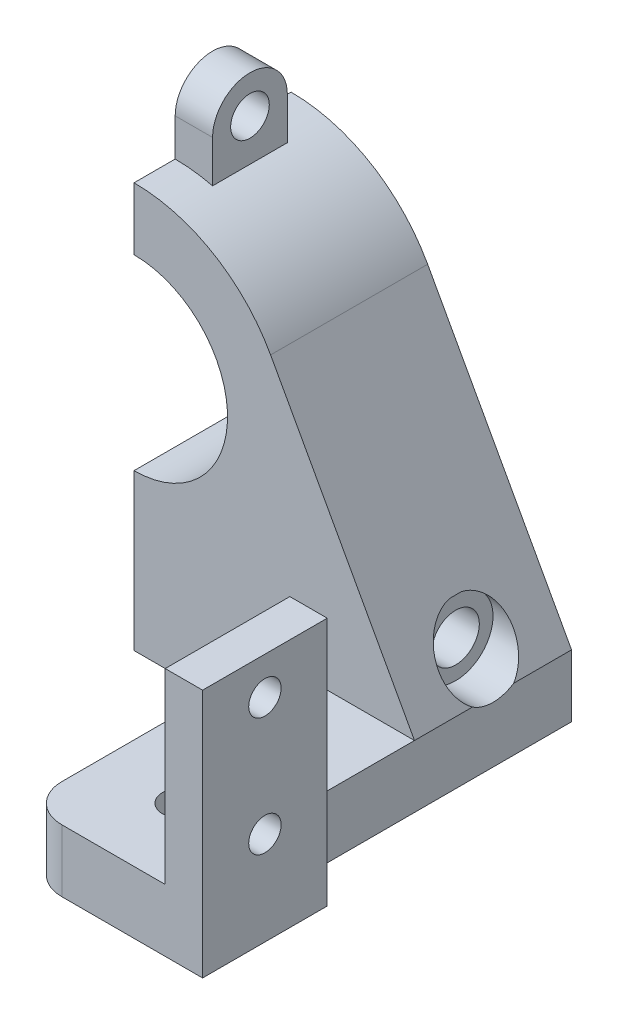
from build123d import *

# Parameters (mm, degrees)
SKETCH_1_R          = 7.5
EXTRUDE_1_DEPTH     = 12.6
SKETCH_2_W          = 11.291748881
SKETCH_2_H          = 5
EXTRUDE_2_DEPTH     = 32.6
SKETCH_3_R          = 1.5
CUT_EXTRUDE_1_DEPTH = 45.373528145
FILLET_1_R          = 3
SKETCH_4_W          = 3
SKETCH_4_H          = 10
EXTRUDE_3_DEPTH     = 20
SKETCH_5_R          = 1.3
CUT_EXTRUDE_2_DEPTH = 46.967488511
SKETCH_6_W          = 35.293936169
SKETCH_6_H          = 34.958158763
CUT_EXTRUDE_3_DEPTH = 46.967488511
EXTRUDE_4_OUTLINE_R = 1.55
EXTRUDE_4_DEPTH     = 3
SKETCH_8_R          = 1.900956558
CUT_EXTRUDE_4_DEPTH = 46.967488511
SKETCH_9_R          = 3
CUT_EXTRUDE_5_DEPTH = 3


# Read off the part's stored shape, not the designer's step: 凸台-拉伸4
with BuildPart() as part:
    # 草图1 → 凸台-拉伸1 (new body)
    with BuildSketch(Plane.XY):
        with BuildLine():
            Line((-10.956194261, 6.017624724), (-22.5, -15))
            Line((-22.5, -15), (-22.5, -20))
            Line((-22.5, -20), (22.5, -20))
            Line((22.5, -20), (22.5, -15))
            Line((22.5, -15), (10.956194261, 6.017624724))
            ThreePointArc((10.956194261, 6.017624724), (0, 12.5), (-10.956194261, 6.017624724))
        make_face()
        Circle(SKETCH_1_R, mode=Mode.SUBTRACT)
    extrude(amount=EXTRUDE_1_DEPTH)

    # 草图2 → 凸台-拉伸2 (add)
    with BuildSketch(Plane.XY):
        with Locations((-16.854125559, -17.5)):
            Rectangle(SKETCH_2_W, SKETCH_2_H)
        with Locations((16.854125559, -17.5)):
            Rectangle(SKETCH_2_W, SKETCH_2_H)
    extrude(amount=EXTRUDE_2_DEPTH)

    # 草图3 → 切除-拉伸1 (cut, through all)
    with BuildSketch(Plane(origin=(0, 0, 0), x_dir=(1, 0, 0), z_dir=(0, 1, 0))):
        with Locations(Location((-17.5, -26.3, 0), (0, 0, 270))):
            Circle(SKETCH_3_R)
        with Locations((17.5, -26.3)):
            Circle(SKETCH_3_R)
    extrude(amount=-CUT_EXTRUDE_1_DEPTH, mode=Mode.SUBTRACT)

    # 圆角1
    fillet_1_edges = [part.edges().sort_by_distance(p)[0] for p in [
        (-22.5, -17.5, 32.6),
        (-11.208251119, -17.5, 32.6),
        (11.208251119, -17.5, 32.6),
    ]]
    fillet(fillet_1_edges, radius=FILLET_1_R)

    # 草图4 → 凸台-拉伸3 (add, through all)
    with BuildSketch(Plane(origin=(0, 0, 0), x_dir=(1, 0, 0), z_dir=(0, 1, 0))):
        with Locations((24, -27.6)):
            Rectangle(SKETCH_4_W, SKETCH_4_H)
    extrude(amount=-EXTRUDE_3_DEPTH)

    # 草图5 → 切除-拉伸2 (cut, through all)
    with BuildSketch(Plane(origin=(0, 0, 0), x_dir=(0, 0, -1), z_dir=(1, 0, 0))):
        with Locations(Location((-27.6, -3, 0), (0, 0, 180))):
            Circle(SKETCH_5_R)
        with Locations(Location((-27.6, -12.5, 0), (0, 0, 180))):
            Circle(SKETCH_5_R)
    extrude(amount=CUT_EXTRUDE_2_DEPTH, mode=Mode.SUBTRACT)

    # 草图6 → 切除-拉伸3 (cut, through all)
    with BuildSketch(Plane(origin=(0, 0, 0), x_dir=(0, 0, -1), z_dir=(1, 0, 0))):
        with Locations((-16.337308601, -3.7126914)):
            Rectangle(SKETCH_6_W, SKETCH_6_H)
    extrude(amount=-CUT_EXTRUDE_3_DEPTH, mode=Mode.SUBTRACT)

    # 凸台-拉伸4 outline → 凸台-拉伸4 (add)
    with BuildSketch(Plane(origin=(0, 0, 0), x_dir=(0, 0, -1), z_dir=(1, 0, 0))):
        with BuildLine():
            Line((-9.3, 15.5), (-9.3, 9.152926334))
            Line((-9.3, 9.152926334), (-3.3, 9.152926334))
            Line((-3.3, 9.152926334), (-3.3, 15.5))
            ThreePointArc((-3.3, 15.5), (-6.3, 18.5), (-9.3, 15.5))
        make_face()
        with Locations((-6.3, 15.5)):
            Circle(EXTRUDE_4_OUTLINE_R, mode=Mode.SUBTRACT)
    extrude(amount=EXTRUDE_4_DEPTH)

    # 草图8 → 切除-拉伸4 (cut, through all)
    with BuildSketch(Plane(origin=(0, 0, 0), x_dir=(0, 0, -1), z_dir=(1, 0, 0))):
        with Locations(Location((-6.3, -12.5, 0), (0, 0, 90))):
            Circle(SKETCH_8_R)
    extrude(amount=CUT_EXTRUDE_4_DEPTH, mode=Mode.SUBTRACT)

    # 草图9 → 切除-拉伸5 (cut)
    with BuildSketch(Plane(origin=(22.5, 0, 0), x_dir=(0, 0, -1), z_dir=(1, 0, 0))):
        with Locations((-6.3, -12.5)):
            Circle(SKETCH_9_R)
    extrude(amount=-CUT_EXTRUDE_5_DEPTH, mode=Mode.SUBTRACT)


solid = part.part
